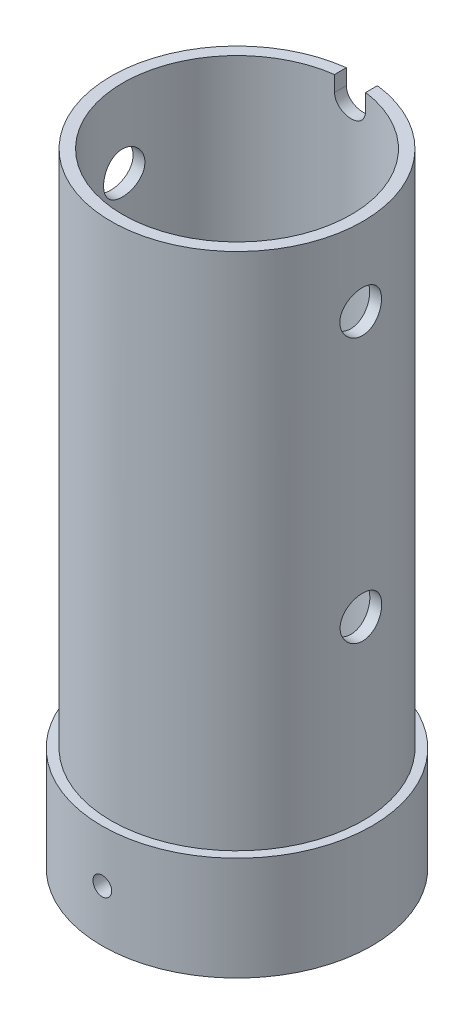
from build123d import *

# Parameters (mm, degrees)
SKETCH_1_R               = 26
SKETCH_1_R_2             = 22
EXTRUDE_1_DEPTH          = 20
SKETCH_3_R               = 24.25
SKETCH_3_R_2             = 22
EXTRUDE_2_DEPTH          = 100
SKETCH_4_R               = 1.8
CUT_EXTRUDE_1_DEPTH      = 100
CUT_EXTRUDE_START        = 100
SKETCH_5_R               = 1.8
CUT_EXTRUDE_2_DEPTH      = 100
CUT_EXTRUDE_3_DEPTH      = 100
CUT_EXTRUDE_3_DEPTH_BACK = 100
SKETCH_6_R               = 4


with BuildPart() as part:
    # 草图1 → 凸台-拉伸1 (new body)
    with BuildSketch(Plane(origin=(0, 0, 0), x_dir=(1, 0, 0), z_dir=(0, 1, 0))):
        Circle(SKETCH_1_R)
        Circle(SKETCH_1_R_2, mode=Mode.SUBTRACT)
    extrude(amount=EXTRUDE_1_DEPTH)

    # 草图3 → 凸台-拉伸2 (add)
    with BuildSketch(Plane(origin=(0, 20, 0), x_dir=(1, 0, 0), z_dir=(0, 1, 0))):
        Circle(SKETCH_3_R)
        Circle(SKETCH_3_R_2, mode=Mode.SUBTRACT)
    extrude(amount=EXTRUDE_2_DEPTH)

    # 草图4 → 切除-拉伸1 (cut)
    with BuildSketch(Plane.XY):
        with Locations((0, 10)):
            Circle(SKETCH_4_R)
        with BuildLine():
            Line((-3, 120), (3, 120))
            Line((3, 120), (3, 117))
            ThreePointArc((3, 117), (0, 114), (-3, 117))
            Line((-3, 117), (-3, 120))
        make_face()
    extrude(amount=-CUT_EXTRUDE_1_DEPTH, mode=Mode.SUBTRACT)

    # 草图5 → 切除-拉伸2 (cut)
    with BuildSketch(Plane.XY.offset(CUT_EXTRUDE_START)):
        with Locations((0, 10)):
            Circle(SKETCH_5_R)
    extrude(amount=-CUT_EXTRUDE_2_DEPTH, mode=Mode.SUBTRACT)

    # 草图6 → 切除-拉伸3 (cut, two sides: drawn at the far end of the back side and taken through both)
    with BuildSketch(Plane(origin=(0, 0, 0), x_dir=(0, 0, -1), z_dir=(1, 0, 0)).offset(-CUT_EXTRUDE_3_DEPTH_BACK)):
        with Locations((-0.089908561, 105)):
            Circle(SKETCH_6_R)
        with Locations((-0.046238689, 54)):
            Circle(SKETCH_6_R)
    extrude(amount=CUT_EXTRUDE_3_DEPTH + CUT_EXTRUDE_3_DEPTH_BACK, mode=Mode.SUBTRACT)


solid = part.part
